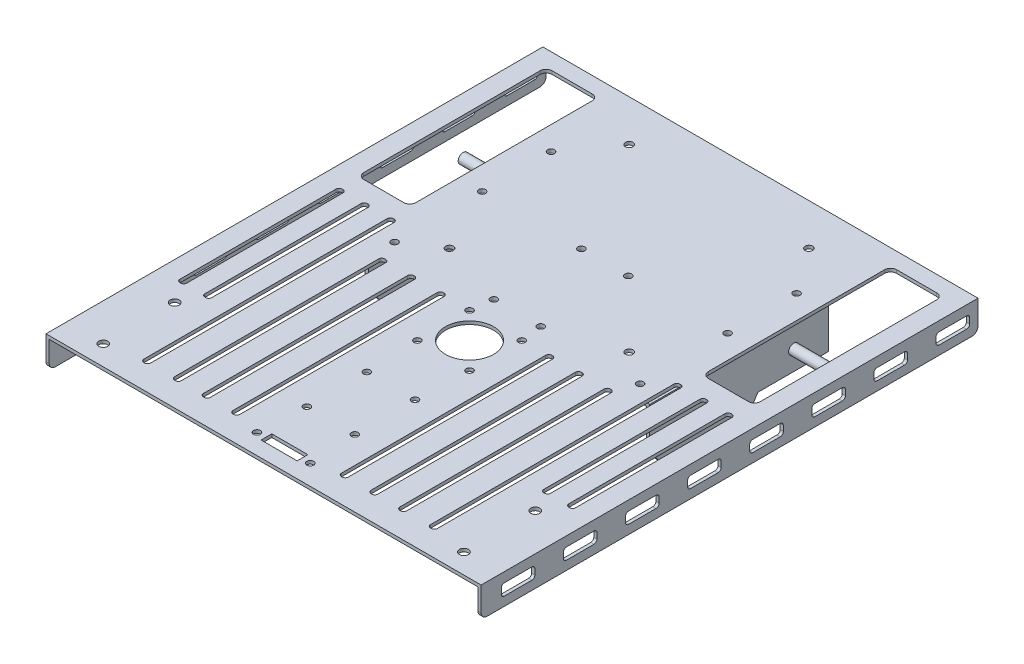
from build123d import *
from build123d.topology import SkipClean

# Parameters (mm, degrees)
SKETCH2_W                = 214
SKETCH2_H                = 248
SKETCH2_W_2              = 26
SKETCH2_H_2              = 94
BOSS_EXTRUDE1_DEPTH      = 1.6
BOSS_EXTRUDE3_DEPTH      = 1.6129
SKETCH6_R                = 1.27
SKETCH6_R_2              = 3
SKETCH6_R_3              = 2.55
BOSS_EXTRUDE4_DEPTH      = 1.6129
SKETCH7_R                = 1.7
SKETCH7_R_2              = 1.9
SKETCH7_R_3              = 2.25
SKETCH7_W                = 9.00529166
SKETCH7_H                = 5.356881788
CUT_EXTRUDE1_DEPTH       = 10
BOSS_EXTRUDE6_DEPTH      = 169
BOSS_EXTRUDE6_DEPTH_BACK = 21
SKETCH9_R                = 2.5
SKETCH11_W               = 1.6
SKETCH11_H               = 248
BOSS_EXTRUDE7_DEPTH      = 15
CUT_EXTRUDE2_DEPTH       = 8
CUT_EXTRUDE3_DEPTH       = 222
FILLET1_R                = 3


with BuildPart() as part:
    # Sketch2 → Boss-Extrude1 (new body)
    with BuildSketch(Plane(origin=(0, 0, 0), x_dir=(1, 0, 0), z_dir=(0, 1, 0))):
        with Locations((-65.266187111, 35.785897091)):
            Rectangle(SKETCH2_W, SKETCH2_H)
        with Locations((-151.266187111, 104.785897091)):
            Rectangle(SKETCH2_W_2, SKETCH2_H_2, mode=Mode.SUBTRACT)
        with Locations((20.733812889, 104.785897091)):
            Rectangle(SKETCH2_W_2, SKETCH2_H_2, mode=Mode.SUBTRACT)
    extrude(amount=BOSS_EXTRUDE1_DEPTH)


with BuildPart() as body_2:
    # Sketch4 → Boss-Extrude3 (new body)
    with BuildSketch(Plane.XZ):
        Polygon((-136.267333078, -122.812619878), (-136.267333078, -33.510319411), (-118.429884942, -33.510319411), (-118.429884942, -55.404375385), (-81.180673519, -55.404375385), (-81.180673519, -32.986733746), (-72.766187111, -32.986733746), (-72.766187111, -87.177277304), (-81.180673519, -87.177277304), (-81.180673519, -65.404375385), (-118.426749597, -65.404375385), (-118.426749597, -122.812619878), align=None)
    extrude(amount=BOSS_EXTRUDE3_DEPTH)

    # Sketch6 → Boss-Extrude4 (add)
    with BuildSketch(Plane(origin=(-136.267333078, 113.834921078, 0), x_dir=(0, -1, 0), z_dir=(1, 0, 0))):
        with BuildLine():
            Line((135.588895095, 122.812619878), (113.834921078, 122.812619878))
            Line((113.834921078, 122.812619878), (113.834921078, 33.510319411))
            Line((113.834921078, 33.510319411), (132.890035435, 33.510319411))
            ThreePointArc((132.890035435, 33.510319411), (151.205721227, 59.659542549), (135.588895095, 87.504846612))
            Line((135.588895095, 87.504846612), (135.588895095, 122.812619878))
        make_face()
        with Locations((123.193301078, 51.685825385)):
            Circle(SKETCH6_R, mode=Mode.SUBTRACT)
        with Locations((133.404101078, 51.685825385)):
            Circle(SKETCH6_R_2, mode=Mode.SUBTRACT)
        with Locations((143.614901078, 51.685825385)):
            Circle(SKETCH6_R, mode=Mode.SUBTRACT)
        with Locations((133.404101078, 73.860025385)):
            Circle(SKETCH6_R, mode=Mode.SUBTRACT)
        with Locations((125.834921078, 105.412619878)):
            Circle(SKETCH6_R_3, mode=Mode.SUBTRACT)
    extrude(amount=BOSS_EXTRUDE4_DEPTH)


with BuildPart() as cut_extrude1_tool:
    # Sketch7 → Cut-Extrude1 (new, symmetric)
    with BuildSketch(Plane.XZ):
        with Locations((-126.541013043, -82.124992621)):
            Circle(SKETCH7_R)
        with Locations((-126.541013043, -38.429929163)):
            Circle(SKETCH7_R)
        with Locations((-76.972284348, -38.429929163)):
            Circle(SKETCH7_R)
        with Locations((-76.972284348, -82.124992621)):
            Circle(SKETCH7_R)
        with Locations((-126.541013043, -116.547553094)):
            Circle(SKETCH7_R)
        with Locations((-110.116187111, -49.429944497)):
            Circle(SKETCH7_R_2)
        with Locations((-110.116187111, -139.129944497)):
            Circle(SKETCH7_R_2)
        with Locations((-155.266187111, 42.570055503)):
            Circle(SKETCH7_R_3)
        with Locations((-78.266187111, -1.593944497)):
            Circle(SKETCH7_R)
        with Locations((-78.266187111, -27.593944497)):
            Circle(SKETCH7_R)
        with Locations((-78.566187111, 78.214102909)):
            Circle(SKETCH7_R)
        with Locations((-77.266187111, 24.634898886)):
            Circle(SKETCH7_R)
        with Locations((-77.266187111, 54.634898886)):
            Circle(SKETCH7_R)
        with Locations((-155.266187111, 78.214102909)):
            Circle(SKETCH7_R_3)
        with BuildLine():
            Line((-65.266187111, -2.593944497), (-65.266187111, -26.593944497))
            ThreePointArc((-65.266187111, -26.593944497), (-77.266187111, -14.593944497), (-65.266187111, -2.593944497))
        make_face()
        with Locations((-69.768832941, 77.779311165)):
            Rectangle(SKETCH7_W, SKETCH7_H)
    cut_extrude1 = extrude(amount=CUT_EXTRUDE1_DEPTH, both=True)


with BuildPart() as part_1:
    add(part.part)

    # Cut-Extrude1: cut by cut_extrude1_tool
    add(cut_extrude1_tool.part, mode=Mode.SUBTRACT)

    # Mirror2: Cut-Extrude1 across plane
    with SkipClean():  # the faces are left unmerged after this step: merging them gives an invalid solid
        add(cut_extrude1.mirror(Plane.ZY.offset(65.266187111)), mode=Mode.SUBTRACT)

    # Sketch11 → Boss-Extrude7 (add)
    with SkipClean():  # the faces are left unmerged after this step: merging them gives an invalid solid
        with BuildSketch(Plane(origin=(0, 1.6, 0), x_dir=(1, 0, 0), z_dir=(0, 1, 0))):
            with Locations((-173.066187111, 35.785897091)):
                Rectangle(SKETCH11_W, SKETCH11_H)
            with Locations((42.533812889, 35.785897091)):
                Rectangle(SKETCH11_W, SKETCH11_H)
        extrude(amount=-BOSS_EXTRUDE7_DEPTH)

    # Sketch12 → Cut-Extrude2 (cut)
    with SkipClean():  # the faces are left unmerged after this step: merging them gives an invalid solid
        with BuildSketch(Plane(origin=(0, 1.6, 0), x_dir=(1, 0, 0), z_dir=(0, 1, 0))):
            with BuildLine():
                Line((-164.036487263, 46.742242586), (-164.036487263, -31.214897517))
                ThreePointArc((-164.036487263, -31.214897517), (-163.597147435, -32.275557689), (-162.536487263, -32.714897517))
                Line((-162.536487263, -32.714897517), (-162.136487263, -32.714897517))
                ThreePointArc((-162.136487263, -32.714897517), (-161.075827091, -32.275557689), (-160.636487263, -31.214897517))
                Line((-160.636487263, -31.214897517), (-160.636487263, 46.742242586))
                ThreePointArc((-160.636487263, 46.742242586), (-161.075827091, 47.802902757), (-162.136487263, 48.242242586))
                Line((-162.136487263, 48.242242586), (-162.536487263, 48.242242586))
                ThreePointArc((-162.536487263, 48.242242586), (-163.597147435, 47.802902757), (-164.036487263, 46.742242586))
            make_face()
            with BuildLine():
                Line((-151.527432849, 46.742242586), (-151.527432849, -31.214897517))
                ThreePointArc((-151.527432849, -31.214897517), (-151.088093021, -32.275557689), (-150.027432849, -32.714897517))
                Line((-150.027432849, -32.714897517), (-149.627432849, -32.714897517))
                ThreePointArc((-149.627432849, -32.714897517), (-148.566772678, -32.275557689), (-148.127432849, -31.214897517))
                Line((-148.127432849, -31.214897517), (-148.127432849, 46.742242586))
                ThreePointArc((-148.127432849, 46.742242586), (-148.566772678, 47.802902757), (-149.627432849, 48.242242586))
                Line((-149.627432849, 48.242242586), (-150.027432849, 48.242242586))
                ThreePointArc((-150.027432849, 48.242242586), (-151.088093021, 47.802902757), (-151.527432849, 46.742242586))
            make_face()
            with BuildLine():
                Line((-138.511721964, 46.742242586), (-138.511721964, -74.712844057))
                ThreePointArc((-138.511721964, -74.712844057), (-138.072382135, -75.773504229), (-137.011721964, -76.212844057))
                Line((-137.011721964, -76.212844057), (-136.611721964, -76.212844057))
                ThreePointArc((-136.611721964, -76.212844057), (-135.551061792, -75.773504229), (-135.111721964, -74.712844057))
                Line((-135.111721964, -74.712844057), (-135.111721964, 46.742242586))
                ThreePointArc((-135.111721964, 46.742242586), (-135.551061792, 47.802902757), (-136.611721964, 48.242242586))
                Line((-136.611721964, 48.242242586), (-137.011721964, 48.242242586))
                ThreePointArc((-137.011721964, 48.242242586), (-138.072382135, 47.802902757), (-138.511721964, 46.742242586))
            make_face()
            with BuildLine():
                Line((-123.223666358, 27.24713171), (-123.223666358, -74.712844057))
                ThreePointArc((-123.223666358, -74.712844057), (-122.78432653, -75.773504229), (-121.723666358, -76.212844057))
                Line((-121.723666358, -76.212844057), (-121.323666358, -76.212844057))
                ThreePointArc((-121.323666358, -76.212844057), (-120.263006186, -75.773504229), (-119.823666358, -74.712844057))
                Line((-119.823666358, -74.712844057), (-119.823666358, 27.24713171))
                ThreePointArc((-119.823666358, 27.24713171), (-120.263006186, 28.307791881), (-121.323666358, 28.74713171))
                Line((-121.323666358, 28.74713171), (-121.723666358, 28.74713171))
                ThreePointArc((-121.723666358, 28.74713171), (-122.78432653, 28.307791881), (-123.223666358, 27.24713171))
            make_face()
            with BuildLine():
                Line((-108.798593801, 27.24713171), (-108.798593801, -74.712844057))
                ThreePointArc((-108.798593801, -74.712844057), (-108.359253972, -75.773504229), (-107.298593801, -76.212844057))
                Line((-107.298593801, -76.212844057), (-106.898593801, -76.212844057))
                ThreePointArc((-106.898593801, -76.212844057), (-105.837933629, -75.773504229), (-105.398593801, -74.712844057))
                Line((-105.398593801, -74.712844057), (-105.398593801, 27.24713171))
                ThreePointArc((-105.398593801, 27.24713171), (-105.837933629, 28.307791881), (-106.898593801, 28.74713171))
                Line((-106.898593801, 28.74713171), (-107.298593801, 28.74713171))
                ThreePointArc((-107.298593801, 28.74713171), (-108.359253972, 28.307791881), (-108.798593801, 27.24713171))
            make_face()
            with BuildLine():
                Line((-94.041762774, 27.24713171), (-94.041762774, -74.712844057))
                ThreePointArc((-94.041762774, -74.712844057), (-93.602422946, -75.773504229), (-92.541762774, -76.212844057))
                Line((-92.541762774, -76.212844057), (-92.141762774, -76.212844057))
                ThreePointArc((-92.141762774, -76.212844057), (-91.081102602, -75.773504229), (-90.641762774, -74.712844057))
                Line((-90.641762774, -74.712844057), (-90.641762774, 27.24713171))
                ThreePointArc((-90.641762774, 27.24713171), (-91.081102602, 28.307791881), (-92.141762774, 28.74713171))
                Line((-92.141762774, 28.74713171), (-92.541762774, 28.74713171))
                ThreePointArc((-92.541762774, 28.74713171), (-93.602422946, 28.307791881), (-94.041762774, 27.24713171))
            make_face()
            with BuildLine():
                Line((-39.890611447, 27.24713171), (-39.890611447, -74.712844057))
                ThreePointArc((-39.890611447, -74.712844057), (-39.451271619, -75.773504229), (-38.390611447, -76.212844057))
                Line((-38.390611447, -76.212844057), (-37.990611447, -76.212844057))
                ThreePointArc((-37.990611447, -76.212844057), (-36.929951276, -75.773504229), (-36.490611447, -74.712844057))
                Line((-36.490611447, -74.712844057), (-36.490611447, 27.24713171))
                ThreePointArc((-36.490611447, 27.24713171), (-36.929951276, 28.307791881), (-37.990611447, 28.74713171))
                Line((-37.990611447, 28.74713171), (-38.390611447, 28.74713171))
                ThreePointArc((-38.390611447, 28.74713171), (-39.451271619, 28.307791881), (-39.890611447, 27.24713171))
            make_face()
            with BuildLine():
                Line((-25.133780421, 27.24713171), (-25.133780421, -74.712844057))
                ThreePointArc((-25.133780421, -74.712844057), (-24.694440593, -75.773504229), (-23.633780421, -76.212844057))
                Line((-23.633780421, -76.212844057), (-23.233780421, -76.212844057))
                ThreePointArc((-23.233780421, -76.212844057), (-22.173120249, -75.773504229), (-21.733780421, -74.712844057))
                Line((-21.733780421, -74.712844057), (-21.733780421, 27.24713171))
                ThreePointArc((-21.733780421, 27.24713171), (-22.173120249, 28.307791881), (-23.233780421, 28.74713171))
                Line((-23.233780421, 28.74713171), (-23.633780421, 28.74713171))
                ThreePointArc((-23.633780421, 28.74713171), (-24.694440593, 28.307791881), (-25.133780421, 27.24713171))
            make_face()
            with BuildLine():
                Line((-10.708707864, 27.24713171), (-10.708707864, -74.712844057))
                ThreePointArc((-10.708707864, -74.712844057), (-10.269368035, -75.773504229), (-9.208707864, -76.212844057))
                Line((-9.208707864, -76.212844057), (-8.808707864, -76.212844057))
                ThreePointArc((-8.808707864, -76.212844057), (-7.748047692, -75.773504229), (-7.308707864, -74.712844057))
                Line((-7.308707864, -74.712844057), (-7.308707864, 27.24713171))
                ThreePointArc((-7.308707864, 27.24713171), (-7.748047692, 28.307791881), (-8.808707864, 28.74713171))
                Line((-8.808707864, 28.74713171), (-9.208707864, 28.74713171))
                ThreePointArc((-9.208707864, 28.74713171), (-10.269368035, 28.307791881), (-10.708707864, 27.24713171))
            make_face()
            with BuildLine():
                Line((4.579347742, 46.742242586), (4.579347742, -74.712844057))
                ThreePointArc((4.579347742, -74.712844057), (5.01868757, -75.773504229), (6.079347742, -76.212844057))
                Line((6.079347742, -76.212844057), (6.479347742, -76.212844057))
                ThreePointArc((6.479347742, -76.212844057), (7.540007914, -75.773504229), (7.979347742, -74.712844057))
                Line((7.979347742, -74.712844057), (7.979347742, 46.742242586))
                ThreePointArc((7.979347742, 46.742242586), (7.540007914, 47.802902757), (6.479347742, 48.242242586))
                Line((6.479347742, 48.242242586), (6.079347742, 48.242242586))
                ThreePointArc((6.079347742, 48.242242586), (5.01868757, 47.802902757), (4.579347742, 46.742242586))
            make_face()
            with BuildLine():
                Line((17.595058628, 46.742242586), (17.595058628, -31.214897517))
                ThreePointArc((17.595058628, -31.214897517), (18.034398456, -32.275557689), (19.095058628, -32.714897517))
                Line((19.095058628, -32.714897517), (19.495058628, -32.714897517))
                ThreePointArc((19.495058628, -32.714897517), (20.5557188, -32.275557689), (20.995058628, -31.214897517))
                Line((20.995058628, -31.214897517), (20.995058628, 46.742242586))
                ThreePointArc((20.995058628, 46.742242586), (20.5557188, 47.802902757), (19.495058628, 48.242242586))
                Line((19.495058628, 48.242242586), (19.095058628, 48.242242586))
                ThreePointArc((19.095058628, 48.242242586), (18.034398456, 47.802902757), (17.595058628, 46.742242586))
            make_face()
            with BuildLine():
                Line((30.104113042, 46.742242586), (30.104113042, -31.214897517))
                ThreePointArc((30.104113042, -31.214897517), (30.54345287, -32.275557689), (31.604113042, -32.714897517))
                Line((31.604113042, -32.714897517), (32.004113042, -32.714897517))
                ThreePointArc((32.004113042, -32.714897517), (33.064773213, -32.275557689), (33.504113042, -31.214897517))
                Line((33.504113042, -31.214897517), (33.504113042, 46.742242586))
                ThreePointArc((33.504113042, 46.742242586), (33.064773213, 47.802902757), (32.004113042, 48.242242586))
                Line((32.004113042, 48.242242586), (31.604113042, 48.242242586))
                ThreePointArc((31.604113042, 48.242242586), (30.54345287, 47.802902757), (30.104113042, 46.742242586))
            make_face()
        extrude(amount=-CUT_EXTRUDE2_DEPTH, mode=Mode.SUBTRACT)

    # Sketch13 → Cut-Extrude3 (cut)
    with SkipClean():  # the faces are left unmerged after this step: merging them gives an invalid solid
        with BuildSketch(Plane.ZY.offset(173.866187111)):
            with BuildLine():
                Line((-154.094314538, -3.230871836), (-140.341066476, -3.230871836))
                ThreePointArc((-140.341066476, -3.230871836), (-139.280406304, -3.670211664), (-138.841066476, -4.730871836))
                Line((-138.841066476, -4.730871836), (-138.841066476, -7.451555842))
                ThreePointArc((-138.841066476, -7.451555842), (-139.280406304, -8.512216014), (-140.341066476, -8.951555842))
                Line((-140.341066476, -8.951555842), (-154.094314538, -8.951555842))
                ThreePointArc((-154.094314538, -8.951555842), (-155.15497471, -8.512216014), (-155.594314538, -7.451555842))
                Line((-155.594314538, -7.451555842), (-155.594314538, -4.730871836))
                ThreePointArc((-155.594314538, -4.730871836), (-155.15497471, -3.670211664), (-154.094314538, -3.230871836))
            make_face()
            with BuildLine():
                Line((-107.841066476, -4.730871836), (-107.841066476, -7.451555842))
                ThreePointArc((-107.841066476, -7.451555842), (-108.280406304, -8.512216014), (-109.341066476, -8.951555842))
                Line((-109.341066476, -8.951555842), (-123.094314538, -8.951555842))
                ThreePointArc((-123.094314538, -8.951555842), (-124.15497471, -8.512216014), (-124.594314538, -7.451555842))
                Line((-124.594314538, -7.451555842), (-124.594314538, -4.730871836))
                ThreePointArc((-124.594314538, -4.730871836), (-124.15497471, -3.670211664), (-123.094314538, -3.230871836))
                Line((-123.094314538, -3.230871836), (-109.341066476, -3.230871836))
                ThreePointArc((-109.341066476, -3.230871836), (-108.280406304, -3.670211664), (-107.841066476, -4.730871836))
            make_face()
            with BuildLine():
                Line((-76.841066476, -4.730871836), (-76.841066476, -7.451555842))
                ThreePointArc((-76.841066476, -7.451555842), (-77.280406304, -8.512216014), (-78.341066476, -8.951555842))
                Line((-78.341066476, -8.951555842), (-92.094314538, -8.951555842))
                ThreePointArc((-92.094314538, -8.951555842), (-93.15497471, -8.512216014), (-93.594314538, -7.451555842))
                Line((-93.594314538, -7.451555842), (-93.594314538, -4.730871836))
                ThreePointArc((-93.594314538, -4.730871836), (-93.15497471, -3.670211664), (-92.094314538, -3.230871836))
                Line((-92.094314538, -3.230871836), (-78.341066476, -3.230871836))
                ThreePointArc((-78.341066476, -3.230871836), (-77.280406304, -3.670211664), (-76.841066476, -4.730871836))
            make_face()
            with BuildLine():
                Line((-45.841066476, -4.730871836), (-45.841066476, -7.451555842))
                ThreePointArc((-45.841066476, -7.451555842), (-46.280406304, -8.512216014), (-47.341066476, -8.951555842))
                Line((-47.341066476, -8.951555842), (-61.094314538, -8.951555842))
                ThreePointArc((-61.094314538, -8.951555842), (-62.15497471, -8.512216014), (-62.594314538, -7.451555842))
                Line((-62.594314538, -7.451555842), (-62.594314538, -4.730871836))
                ThreePointArc((-62.594314538, -4.730871836), (-62.15497471, -3.670211664), (-61.094314538, -3.230871836))
                Line((-61.094314538, -3.230871836), (-47.341066476, -3.230871836))
                ThreePointArc((-47.341066476, -3.230871836), (-46.280406304, -3.670211664), (-45.841066476, -4.730871836))
            make_face()
            with BuildLine():
                Line((-14.841066476, -4.730871836), (-14.841066476, -7.451555842))
                ThreePointArc((-14.841066476, -7.451555842), (-15.280406304, -8.512216014), (-16.341066476, -8.951555842))
                Line((-16.341066476, -8.951555842), (-30.094314538, -8.951555842))
                ThreePointArc((-30.094314538, -8.951555842), (-31.15497471, -8.512216014), (-31.594314538, -7.451555842))
                Line((-31.594314538, -7.451555842), (-31.594314538, -4.730871836))
                ThreePointArc((-31.594314538, -4.730871836), (-31.15497471, -3.670211664), (-30.094314538, -3.230871836))
                Line((-30.094314538, -3.230871836), (-16.341066476, -3.230871836))
                ThreePointArc((-16.341066476, -3.230871836), (-15.280406304, -3.670211664), (-14.841066476, -4.730871836))
            make_face()
            with BuildLine():
                Line((16.158933524, -4.730871836), (16.158933524, -7.451555842))
                ThreePointArc((16.158933524, -7.451555842), (15.719593696, -8.512216014), (14.658933524, -8.951555842))
                Line((14.658933524, -8.951555842), (0.905685462, -8.951555842))
                ThreePointArc((0.905685462, -8.951555842), (-0.15497471, -8.512216014), (-0.594314538, -7.451555842))
                Line((-0.594314538, -7.451555842), (-0.594314538, -4.730871836))
                ThreePointArc((-0.594314538, -4.730871836), (-0.15497471, -3.670211664), (0.905685462, -3.230871836))
                Line((0.905685462, -3.230871836), (14.658933524, -3.230871836))
                ThreePointArc((14.658933524, -3.230871836), (15.719593696, -3.670211664), (16.158933524, -4.730871836))
            make_face()
            with BuildLine():
                Line((47.158933524, -4.730871836), (47.158933524, -7.451555842))
                ThreePointArc((47.158933524, -7.451555842), (46.719593696, -8.512216014), (45.658933524, -8.951555842))
                Line((45.658933524, -8.951555842), (31.905685462, -8.951555842))
                ThreePointArc((31.905685462, -8.951555842), (30.84502529, -8.512216014), (30.405685462, -7.451555842))
                Line((30.405685462, -7.451555842), (30.405685462, -4.730871836))
                ThreePointArc((30.405685462, -4.730871836), (30.84502529, -3.670211664), (31.905685462, -3.230871836))
                Line((31.905685462, -3.230871836), (45.658933524, -3.230871836))
                ThreePointArc((45.658933524, -3.230871836), (46.719593696, -3.670211664), (47.158933524, -4.730871836))
            make_face()
            with BuildLine():
                Line((78.158933524, -4.730871836), (78.158933524, -7.451555842))
                ThreePointArc((78.158933524, -7.451555842), (77.719593696, -8.512216014), (76.658933524, -8.951555842))
                Line((76.658933524, -8.951555842), (62.905685462, -8.951555842))
                ThreePointArc((62.905685462, -8.951555842), (61.84502529, -8.512216014), (61.405685462, -7.451555842))
                Line((61.405685462, -7.451555842), (61.405685462, -4.730871836))
                ThreePointArc((61.405685462, -4.730871836), (61.84502529, -3.670211664), (62.905685462, -3.230871836))
                Line((62.905685462, -3.230871836), (76.658933524, -3.230871836))
                ThreePointArc((76.658933524, -3.230871836), (77.719593696, -3.670211664), (78.158933524, -4.730871836))
            make_face()
        extrude(amount=-CUT_EXTRUDE3_DEPTH, mode=Mode.SUBTRACT)

    # Fillet1
    fillet1_edges = [part_1.edges().sort_by_distance(p)[0] for p in [
        (-173.066187111, -13.4, 88.214102909),
        (-173.066187111, -13.4, -159.785897091),
        (42.533812889, -13.4, -159.785897091),
        (42.533812889, -13.4, 88.214102909),
        (-138.266187111, 0.8, -57.785897091),
        (-164.266187111, 0.8, -151.785897091),
        (-164.266187111, 0.8, -57.785897091),
        (-138.266187111, 0.8, -151.785897091),
        (33.733812889, 0.8, -151.785897091),
        (7.733812889, 0.8, -151.785897091),
        (33.733812889, 0.8, -57.785897091),
        (7.733812889, 0.8, -57.785897091),
    ]]
    fillet(fillet1_edges, radius=FILLET1_R)


with BuildPart() as body_2_1:
    add(body_2.part)

    # Cut-Extrude1: cut by cut_extrude1_tool
    add(cut_extrude1_tool.part, mode=Mode.SUBTRACT)


with BuildPart() as body_3:
    # Mirror1: mirrored copy
    add(body_2_1.part.mirror(Plane.ZY.offset(65.266187111)))


with BuildPart() as body_4:
    # Sketch9 → Boss-Extrude6 (new, two sides: drawn at the far end of the back side and taken through both)
    with BuildSketch(Plane(origin=(-138.266187111, 0, 0), x_dir=(0, 0, -1), z_dir=(1, 0, 0)).offset(-BOSS_EXTRUDE6_DEPTH_BACK)):
        with Locations((105.412619878, -12)):
            Circle(SKETCH9_R)
    extrude(amount=BOSS_EXTRUDE6_DEPTH + BOSS_EXTRUDE6_DEPTH_BACK)


solid = Compound([part_1.part, body_2_1.part, body_3.part, body_4.part])
